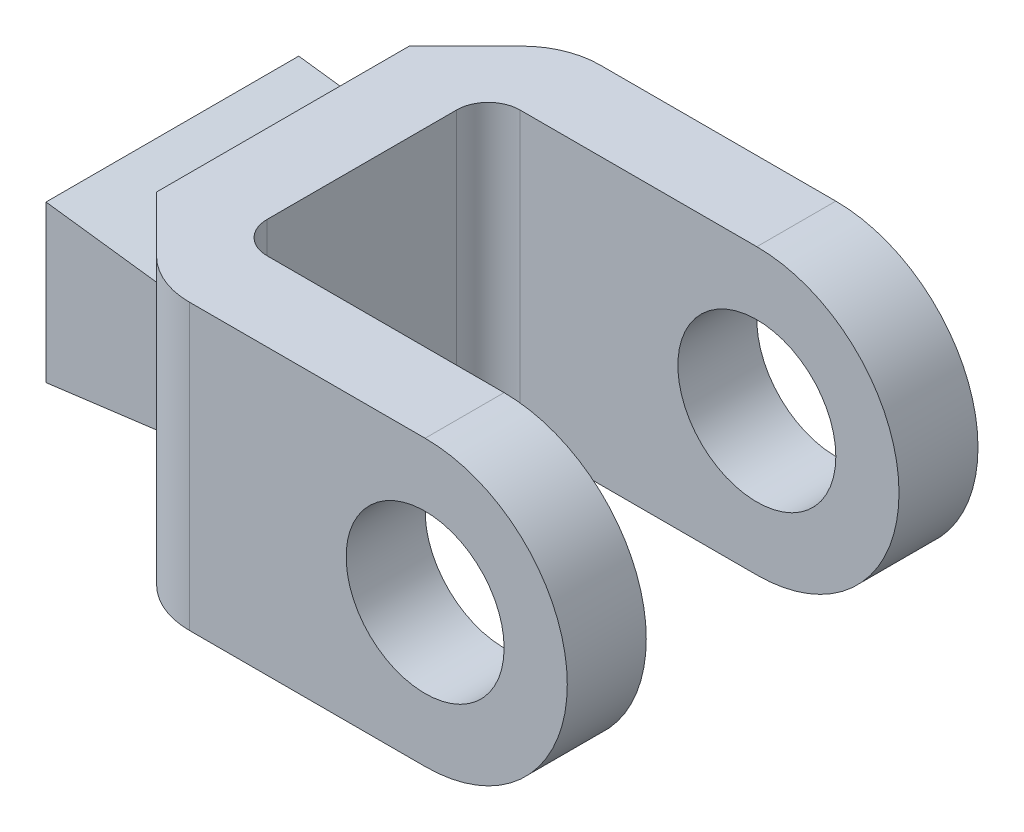
from build123d import *

# Parameters (mm, degrees)
BOSS_EXTRUDE1_DEPTH  = 8
SKETCH2_R            = 2.5
BOSS_EXTRUDE3_DEPTH  = 2.5
CUT_EXTRUDE2_DEPTH   = 20.54002303
FILLET5_R            = 1
FILLET6_R            = 2.5
FILLET5_OF_MIRROR2_R = 1
FILLET6_OF_MIRROR2_R = 2.5


with BuildPart() as part:
    # Sketch1 → Boss-Extrude1 (new body)
    with BuildSketch(Plane.XY):
        Polygon((-1.75, -2.475), (-1.75, 2.475), (1.75, 2.025), (1.75, 4.5), (4.25, 4.5), (4.25, -4.5), (1.75, -4.5), (1.75, -2.025), align=None)
    extrude(amount=BOSS_EXTRUDE1_DEPTH)

    # Sketch2 → Boss-Extrude3 (add)
    with BuildSketch(Plane.XY):
        with BuildLine():
            Line((12.75, -4.5), (1.75, -4.5))
            Line((1.75, -4.5), (1.75, 4.5))
            Line((1.75, 4.5), (12.75, 4.5))
            ThreePointArc((12.75, 4.5), (17.25, 0), (12.75, -4.5))
        make_face()
        with Locations((12.75, 0)):
            Circle(SKETCH2_R, mode=Mode.SUBTRACT)
    boss_extrude3 = extrude(amount=-BOSS_EXTRUDE3_DEPTH)

    # Sketch5 → Cut-Extrude2 (cut, symmetric)
    with BuildSketch(Plane(origin=(0, 0, 0), x_dir=(1, 0, 0), z_dir=(0, 1, 0))):
        Polygon((1.75, 0), (4.25, 2.5), (1.75, 2.5), align=None)
    cut_extrude2 = extrude(amount=CUT_EXTRUDE2_DEPTH, both=True, mode=Mode.SUBTRACT)

    # Fillet5
    fillet5_edges = [part.edges().sort_by_distance(p)[0] for p in [
        (4.25, 0, 0),
    ]]
    fillet(fillet5_edges, radius=FILLET5_R)

    # Fillet6
    fillet6_edges = [part.edges().sort_by_distance(p)[0] for p in [
        (4.25, 0, -2.5),
    ]]
    fillet(fillet6_edges, radius=FILLET6_R)

    # Mirror2: Boss-Extrude3, Cut-Extrude2 across plane
    add(boss_extrude3.mirror(Plane(origin=(0, 0, 4), x_dir=(1, 0, 0), z_dir=(0, 0, -1))))
    add(cut_extrude2.mirror(Plane(origin=(0, 0, 4), x_dir=(1, 0, 0), z_dir=(0, 0, -1))), mode=Mode.SUBTRACT)

    # Fillet5 of Mirror2
    fillet5_of_mirror2_edges = [part.edges().sort_by_distance(p)[0] for p in [
        (4.25, 0, 8),
    ]]
    fillet(fillet5_of_mirror2_edges, radius=FILLET5_OF_MIRROR2_R)

    # Fillet6 of Mirror2
    fillet6_of_mirror2_edges = [part.edges().sort_by_distance(p)[0] for p in [
        (4.25, 0, 10.5),
    ]]
    fillet(fillet6_of_mirror2_edges, radius=FILLET6_OF_MIRROR2_R)


solid = part.part
